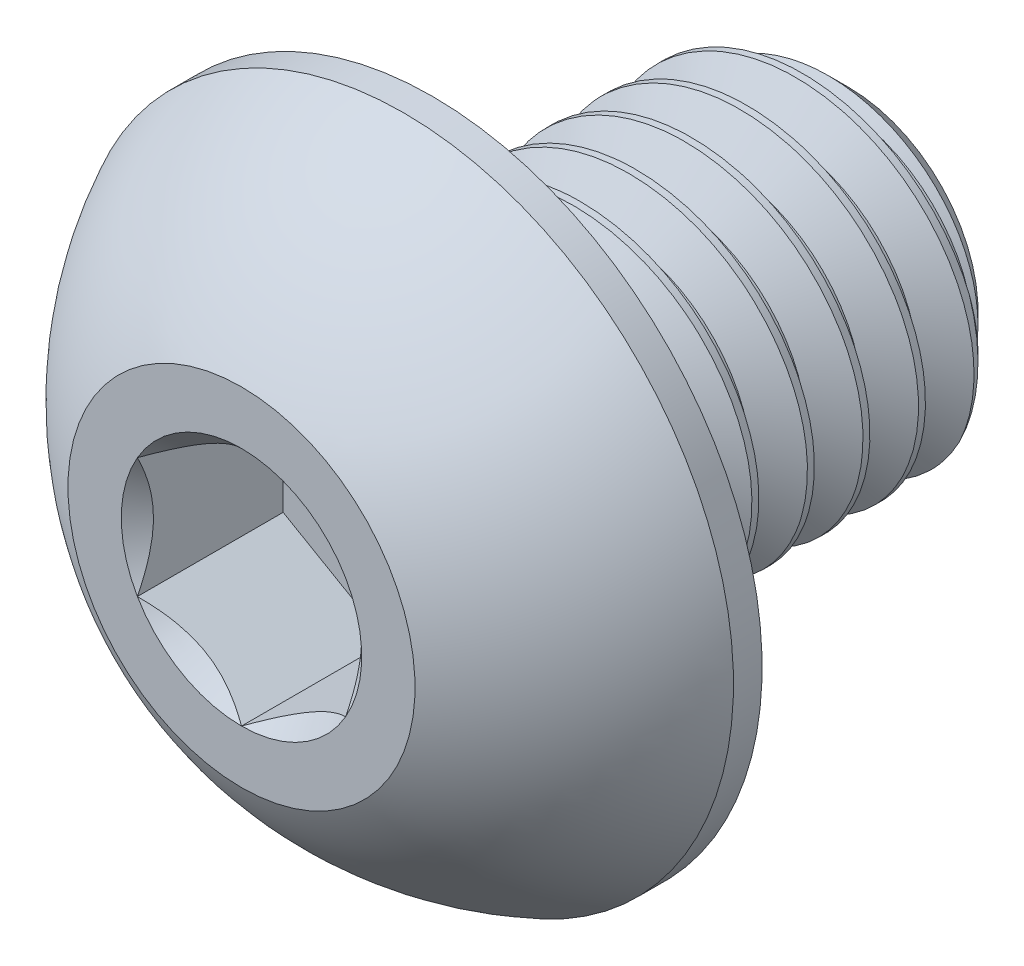
from build123d import *

# Parameters (mm, degrees)
CUT_EXTRUDE1_DEPTH = 2.1
CUT_SWEEP1_PITCH   = 0.8


# Read off the part's stored shape, not the designer's step: Split1, Boss-Extrude1
with BuildPart() as part:
    # Sketch2 → Revolve1 (revolve)
    with BuildSketch(Plane(origin=(0, 0, 0), x_dir=(0, 0, -1), z_dir=(1, 0, 0)), mode=Mode.PRIVATE) as revolve1_sk:
        with BuildLine():
            Line((-4.375, 0), (4.375, 0))
            Line((4.375, 0), (4.375, 1.86))
            Line((4.375, 1.86), (3.735, 2.5))
            Line((3.735, 2.5), (-1.625, 2.5))
            Line((-1.625, 2.5), (-1.625, 4.75))
            Line((-1.625, 4.75), (-2.0375, 4.75))
            ThreePointArc((-2.0375, 4.75), (-3.383124817, 3.808753282), (-4.375, 2.5))
            Line((-4.375, 2.5), (-4.375, 0))
        make_face()
    revolve(revolve1_sk.sketch.rotate(Axis((0, 0, 4.375), (0, 0, -1)), 180), axis=Axis((0, 0, 4.375), (0, 0, -1)))

    # Sketch3 → Cut-Extrude1 (cut)
    with BuildSketch(Plane.XY.offset(4.375)):
        Polygon((0, 1.732050808), (-1.5, 0.866025404), (-1.5, -0.866025404), (0, -1.732050808), (1.5, -0.866025404), (1.5, 0.866025404), align=None)
    extrude(amount=-CUT_EXTRUDE1_DEPTH, mode=Mode.SUBTRACT)

    # Cut-Extrude2 cone 1 section (through the dimple's axis) → Cut-Extrude2 (revolve, cut)
    with BuildSketch(Plane(origin=(0, 0, 4.375), x_dir=(0, -1, 0), z_dir=(1, 0, 0))):
        Polygon((0, 0), (1.732050808, 0), (0, 1.732050808), align=None)
    revolve(axis=Axis((0, 0, 4.375), (0, 0, -1)), mode=Mode.SUBTRACT)


with BuildPart() as body_2:
    # Split1: the piece on the far side of the plane
    add(part.part)
    split(bisect_by=Plane.XY.offset(1.625), keep=Keep.BOTTOM)

    # Cut-Sweep1: the profile of Sketch6 screwed along a right-hand helix of 8.5 turns, 8 arcs to a turn; built about Z, then put on its axis
    cut_sweep1_z = Axis((0, 0, 0), (0, 0, 1))
    cut_sweep1_corners = [(1.980384758, 0, -0.3), (1.980384758, 0, -0.4), (2.54330127, 0, -0.725), (2.54330127, 0, 0.025)]
    with BuildLine(mode=Mode.PRIVATE) as cut_sweep1_profile:
        Line(cut_sweep1_corners[0], cut_sweep1_corners[1])
        Line(cut_sweep1_corners[1], cut_sweep1_corners[2])
        Line(cut_sweep1_corners[2], cut_sweep1_corners[3])
        Line(cut_sweep1_corners[3], cut_sweep1_corners[0])
    cut_sweep1_cap = Face(cut_sweep1_profile.wire())
    cut_sweep1_turn_angles = [0, 22.5, 45, 67.5, 90, 112.5, 135, 157.5, 180, 202.5, 225, 247.5, 270, 292.5, 315, 337.5, 360]
    cut_sweep1_turn_weights = [1, 0.9238795325112867, 1, 0.9238795325112867, 1, 0.9238795325112867, 1, 0.9238795325112867, 1, 0.9238795325112867, 1, 0.9238795325112867, 1, 0.9238795325112867, 1, 0.9238795325112867, 1]
    cut_sweep1_turn_rails = [Edge.make_bspline([Vector(p[0], p[1], 0).rotate(cut_sweep1_z, cut_sweep1_turn_angles[k]) / cut_sweep1_turn_weights[k] + Vector(0, 0, p[2] + CUT_SWEEP1_PITCH * cut_sweep1_turn_angles[k] / 360) for k in range(17)], [0, 0, 0, 1, 1, 2, 2, 3, 3, 4, 4, 5, 5, 6, 6, 7, 7, 8, 8, 8], 2, cut_sweep1_turn_weights) for p in cut_sweep1_corners]
    cut_sweep1_turn_sides = [Face.make_surface_from_curves(cut_sweep1_turn_rails[p[0]], cut_sweep1_turn_rails[p[1]]) for p in [(0, 1), (1, 2), (2, 3), (3, 0)]]
    cut_sweep1_turn = Solid(Shell([*cut_sweep1_turn_sides, cut_sweep1_cap, cut_sweep1_cap.rotate(cut_sweep1_z, 360).moved(Location((0, 0, CUT_SWEEP1_PITCH * 360 / 360)))]))
    cut_sweep1_last_angles = [2880, 2902.5, 2925, 2947.5, 2970, 2992.5, 3015, 3037.5, 3060]
    cut_sweep1_last_weights = [1, 0.9238795325112867, 1, 0.9238795325112867, 1, 0.9238795325112867, 1, 0.9238795325112958, 1]
    cut_sweep1_last_rails = [Edge.make_bspline([Vector(p[0], p[1], 0).rotate(cut_sweep1_z, cut_sweep1_last_angles[k]) / cut_sweep1_last_weights[k] + Vector(0, 0, p[2] + CUT_SWEEP1_PITCH * cut_sweep1_last_angles[k] / 360) for k in range(9)], [0, 0, 0, 1, 1, 2, 2, 3, 3, 4, 4, 4], 2, cut_sweep1_last_weights) for p in cut_sweep1_corners]
    cut_sweep1_last_sides = [Face.make_surface_from_curves(cut_sweep1_last_rails[p[0]], cut_sweep1_last_rails[p[1]]) for p in [(0, 1), (1, 2), (2, 3), (3, 0)]]
    cut_sweep1_last = Solid(Shell([*cut_sweep1_last_sides, cut_sweep1_cap.rotate(cut_sweep1_z, 2880).moved(Location((0, 0, CUT_SWEEP1_PITCH * 2880 / 360))), cut_sweep1_cap.rotate(cut_sweep1_z, 3060).moved(Location((0, 0, CUT_SWEEP1_PITCH * 3060 / 360)))]))
    cut_sweep1_each = [*[cut_sweep1_turn.moved(Location((0, 0, CUT_SWEEP1_PITCH * i))) for i in range(8)], cut_sweep1_last]
    add(Plane(origin=(0, 0, -4.375), x_dir=(0, 1, 0), z_dir=(0, 0, 1)) * Compound([cut_sweep1_each[i] for i in range(0, 9, 2)]), mode=Mode.SUBTRACT)
    add(Plane(origin=(0, 0, -4.375), x_dir=(0, 1, 0), z_dir=(0, 0, 1)) * Compound([cut_sweep1_each[i] for i in range(1, 9, 2)]), mode=Mode.SUBTRACT)


with BuildPart() as part_1:
    add(part.part)

    # Split1
    split(bisect_by=Plane.XY.offset(1.625), keep=Keep.TOP)

    add(body_2.part)  # Boss-Extrude1 merges body 2
    # Boss-Extrude1 outline → Boss-Extrude1 (revolve)
    with BuildSketch(Plane.XZ):
        Polygon((1.980382722, 1.625), (1.980382722, 0.724996474), (2.5, 1.625), align=None)
    revolve(axis=Axis((0, 0, 0), (0, 0, 1)))


solid = part_1.part
